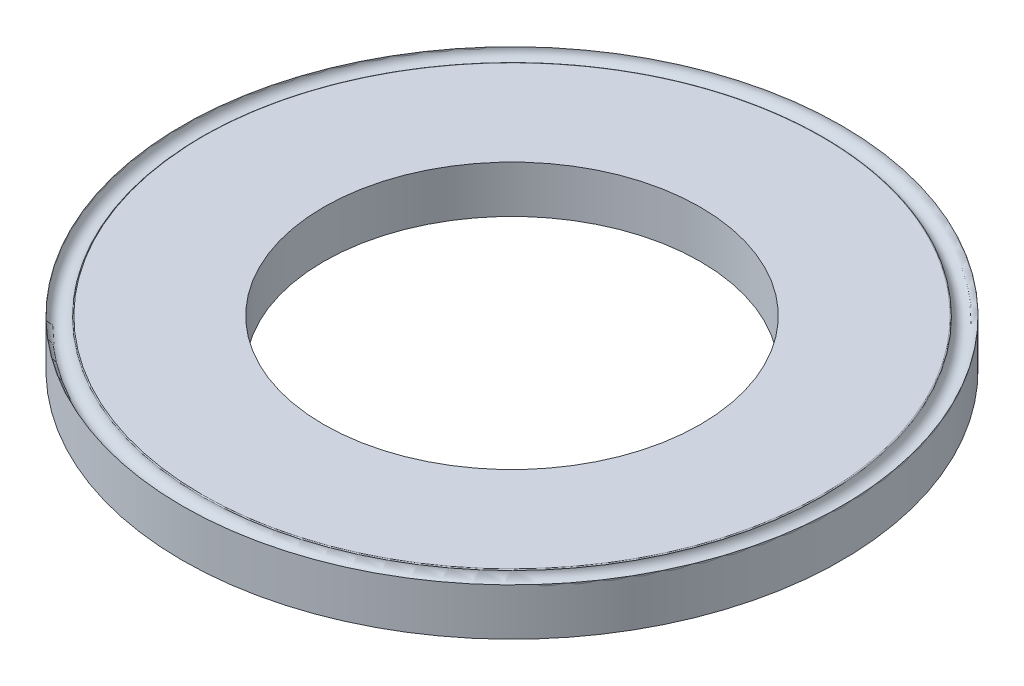
from build123d import *

# Parameters (mm, degrees)
DIAPROFILES_R    = 3.5
DIAPROFILES_R_2  = 2
DIAPROFILE_DEPTH = 0.25


with BuildPart() as part:
    # DiaProfileS → DiaProfile (new, symmetric)
    with BuildSketch(Plane(origin=(0, 0, 0), x_dir=(1, 0, 0), z_dir=(0, 1, 0))):
        Circle(DIAPROFILES_R)
        Circle(DIAPROFILES_R_2, mode=Mode.SUBTRACT)
    extrude(amount=DIAPROFILE_DEPTH, both=True)

    # CrimpS → Crimp (revolve, cut)
    with BuildSketch(Plane.XY):
        with BuildLine():
            Line((-3.5, 0.25), (-3.290455488, 0.25))
            ThreePointArc((-3.290455488, 0.25), (-3.297197487, 0.247385489), (-3.30041408, 0.240909091))
            ThreePointArc((-3.30041408, 0.240909091), (-3.404550167, 0.150103574), (-3.5, 0.25))
        make_face()
    revolve(axis=Axis((0, 0.25, 0), (0, -1, 0)), mode=Mode.SUBTRACT)


solid = part.part
